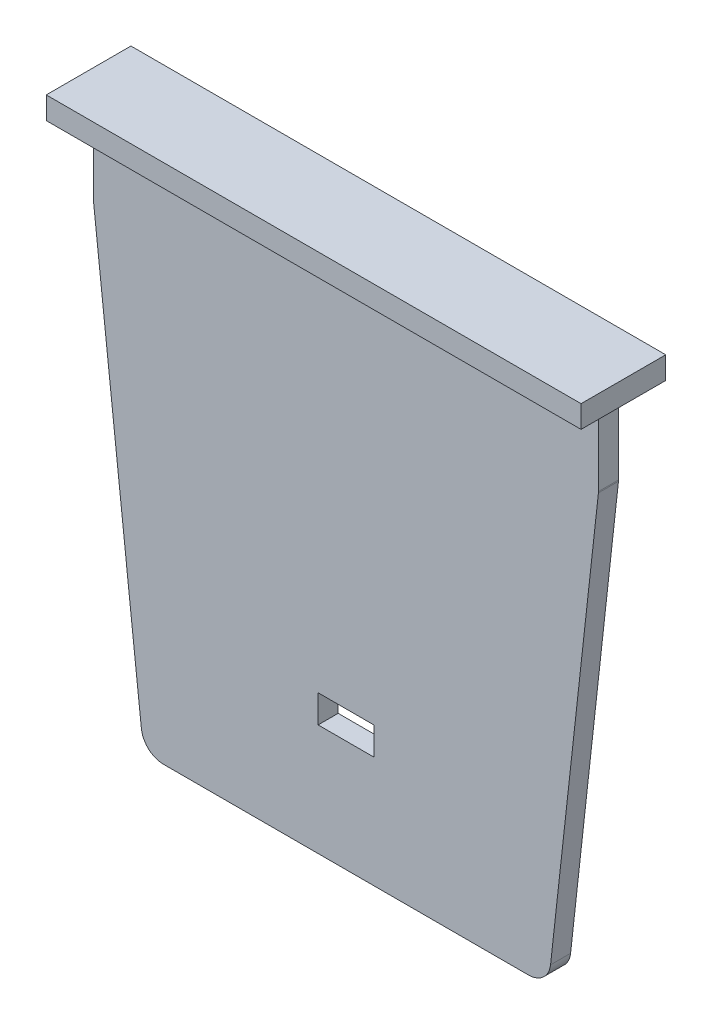
from build123d import *

# Parameters (mm, degrees)
BOSS_EXTRUDE1_DEPTH = 4.572
SKETCH3_W           = 115.1315452
SKETCH3_H           = 4.572
BOSS_EXTRUDE2_DEPTH = 17.78
FILLET1_R           = 2.54
SKETCH4_W           = 121.92
SKETCH4_H           = 19.304
BOSS_EXTRUDE4_DEPTH = 5.08
SKETCH5_W           = 12.7
SKETCH5_H           = 6.35
CUT_EXTRUDE1_DEPTH  = 5.08


with BuildPart() as part:
    # Sketch2 → Boss-Extrude1 (new body)
    with BuildSketch(Plane(origin=(0, 0, 0), x_dir=(-1, 0, 0), z_dir=(0, 0, -1))):
        with BuildLine():
            Line((-62.487415839, 48.848476089), (52.644129361, 48.848476089))
            Line((52.644129361, 48.848476089), (41.713156468, -49.932022311))
            ThreePointArc((41.713156468, -49.932022311), (40.052782988, -53.157778108), (36.663977171, -54.453284069))
            Line((36.663977171, -54.453284069), (-46.507263649, -54.453284069))
            ThreePointArc((-46.507263649, -54.453284069), (-49.896069466, -53.157778108), (-51.556442946, -49.932022311))
            Line((-51.556442946, -49.932022311), (-62.487415839, 48.848476089))
        make_face()
    extrude(amount=BOSS_EXTRUDE1_DEPTH)

    # Sketch3 → Boss-Extrude2 (add)
    with BuildSketch(Plane(origin=(0, 48.848476089, 0), x_dir=(1, 0, 0), z_dir=(0, 1, 0))):
        with Locations((4.921643239, 2.286)):
            Rectangle(SKETCH3_W, SKETCH3_H)
    extrude(amount=BOSS_EXTRUDE2_DEPTH)

    # Fillet1
    fillet1_edges = [part.edges().sort_by_distance(p)[0] for p in [
        (62.487415839, 48.848476089, -2.286),
        (-52.644129361, 48.848476089, -2.286),
    ]]
    fillet(fillet1_edges, radius=FILLET1_R)

    # Sketch4 → Boss-Extrude4 (add)
    with BuildSketch(Plane(origin=(0, 66.628476089, 0), x_dir=(1, 0, 0), z_dir=(0, 1, 0))):
        with Locations((4.921643239, 2.286)):
            Rectangle(SKETCH4_W, SKETCH4_H)
    extrude(amount=BOSS_EXTRUDE4_DEPTH)

    # Sketch5 → Cut-Extrude1 (cut)
    with BuildSketch(Plane(origin=(0, 0, -4.572), x_dir=(-1, 0, 0), z_dir=(0, 0, -1))):
        with Locations((-4.921643239, -25.878284069)):
            Rectangle(SKETCH5_W, SKETCH5_H)
    extrude(amount=-CUT_EXTRUDE1_DEPTH, mode=Mode.SUBTRACT)


solid = part.part
